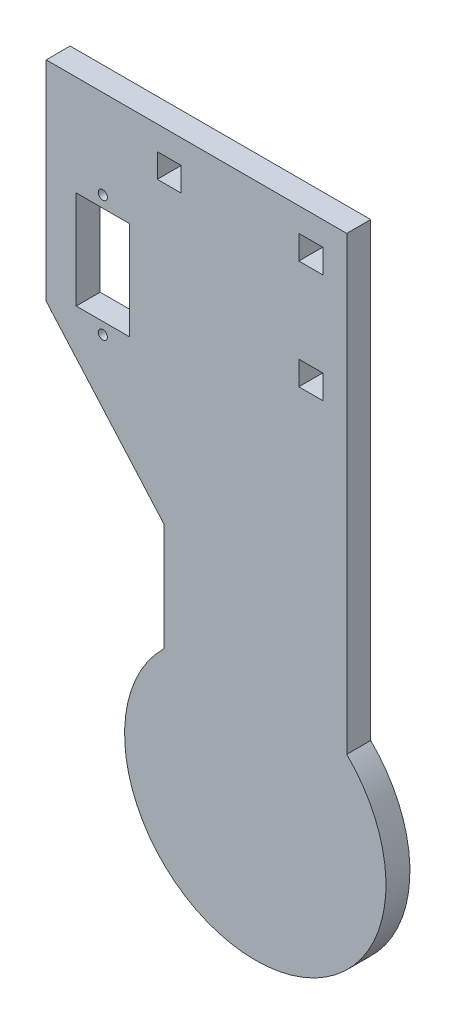
from build123d import *

# Parameters (mm, degrees)
EXTRUDE_1_DEPTH     = 5.5
SKETCH_2_W          = 12.2
SKETCH_2_H          = 22.5
CUT_EXTRUDE_1_DEPTH = 135.012126317
SKETCH_4_R          = 1.05
SKETCH_4_W          = 5.5
SKETCH_4_H          = 5.5
CUT_EXTRUDE_2_DEPTH = 135.012126317


with BuildPart() as part:
    # ｽｹｯﾁ1 → ﾎﾞｽ - 押し出し1 (new body)
    with BuildSketch(Plane.XY):
        with BuildLine():
            Line((21, 125), (-48, 125))
            Line((-48, 125), (-48, 77))
            Line((-48, 77), (-21, 46.261860468))
            Line((-21, 46.261860468), (-21, 21.424285286))
            ThreePointArc((-21, 21.424285286), (0, -30), (21, 21.424285286))
            Line((21, 21.424285286), (21, 125))
        make_face()
    extrude(amount=EXTRUDE_1_DEPTH)

    # ｽｹｯﾁ2 → ｶｯﾄ - 押し出し1 (cut, through all)
    with BuildSketch(Plane.XY.offset(5.5)):
        with Locations((-35, 90.75)):
            Rectangle(SKETCH_2_W, SKETCH_2_H)
    extrude(amount=-CUT_EXTRUDE_1_DEPTH, mode=Mode.SUBTRACT)

    # ｽｹｯﾁ4 → ｶｯﾄ - 押し出し2 (cut, through all)
    with BuildSketch(Plane.XY.offset(5.5)):
        with Locations((-35, 104.65)):
            Circle(SKETCH_4_R)
        with Locations((-35, 76.85)):
            Circle(SKETCH_4_R)
        with Locations((12.75, 116.75)):
            Rectangle(SKETCH_4_W, SKETCH_4_H)
        with Locations((-19.75, 116.75)):
            Rectangle(SKETCH_4_W, SKETCH_4_H)
        with Locations((12.75, 91.75)):
            Rectangle(SKETCH_4_W, SKETCH_4_H)
    extrude(amount=-CUT_EXTRUDE_2_DEPTH, mode=Mode.SUBTRACT)


solid = part.part
